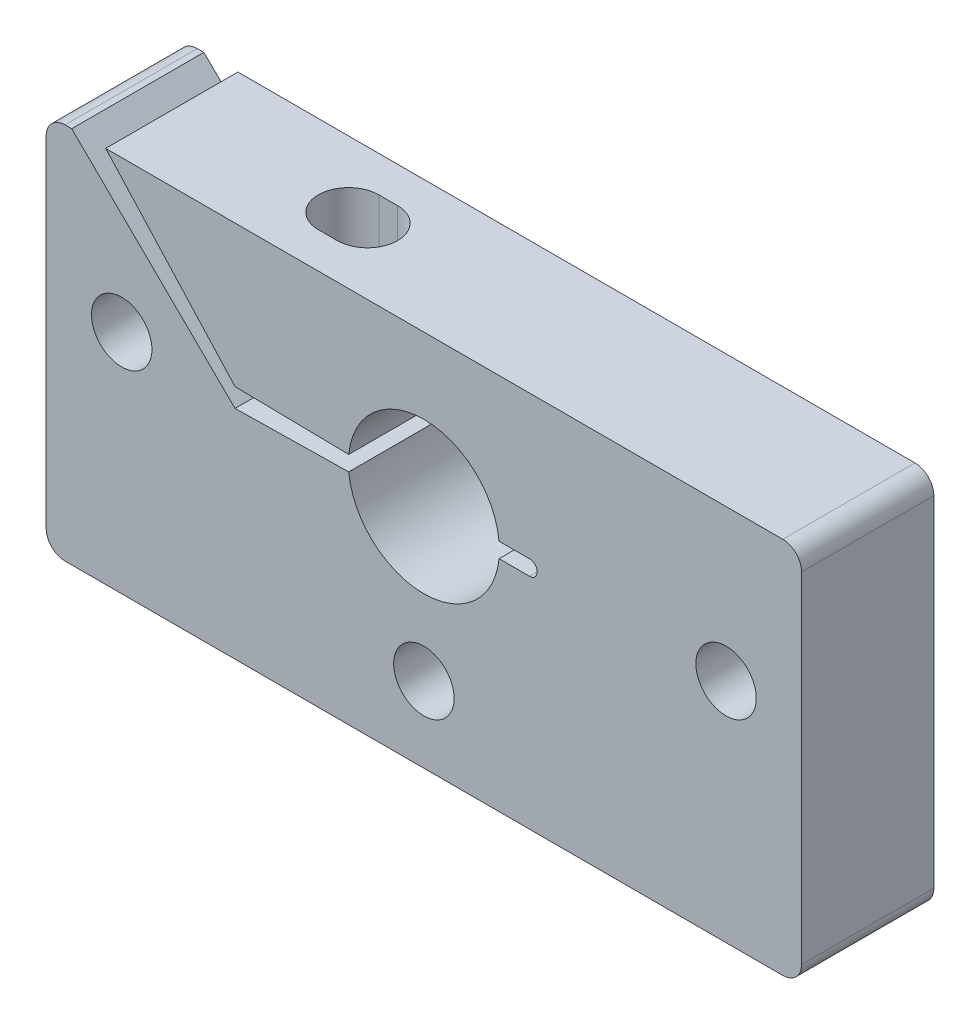
from build123d import *

# Parameters (mm, degrees)
BOSS_EXTRUDE1_DEPTH      = 3.5
BOSS_EXTRUDE1_DEPTH_BACK = 3.5
SKETCH1_R                = 1.6
CUT_EXTRUDE1_REACH       = 30.5
SKETCH3_R                = 1.6
SKETCH3_3_R              = 2.2
SKETCH3_3_R_2            = 1.6
CUT_EXTRUDE2_DEPTH       = 6
CUT_EXTRUDE3_REACH       = 30.5
FILLET1_R                = 1
FILLET2_R                = 0.4


with BuildPart() as part:
    # Sketch1 → Boss-Extrude1 (new, two sides: drawn at the far end of the back side and taken through both)
    with BuildSketch(Plane.XY.offset(-BOSS_EXTRUDE1_DEPTH_BACK)):
        with BuildLine():
            Line((-20, 8), (-18.64966284, 8))
            Line((-18.64966284, 8), (-10, -0.5))
            Line((-10, -0.5), (-3.979949748, -0.4))
            ThreePointArc((-3.979949748, -0.4), (0, -4), (3.979949748, -0.4))
            Line((3.979949748, -0.4), (6, -0.4))
            Line((6, -0.4), (6, 0.4))
            Line((6, 0.4), (3.979949748, 0.4))
            ThreePointArc((3.979949748, 0.4), (0, 4), (-3.979949748, 0.4))
            Line((-3.979949748, 0.4), (-10, 0.5))
            Line((-10, 0.5), (-16.848441102, 8))
            Line((-16.848441102, 8), (20, 8))
            Line((20, 8), (20, -12))
            Line((20, -12), (-20, -12))
            Line((-20, -12), (-20, 8))
        make_face()
        with Locations((-16, 0)):
            Circle(SKETCH1_R, mode=Mode.SUBTRACT)
        with Locations(Location((16, 0, 0), (0, 0, 180))):
            Circle(SKETCH1_R, mode=Mode.SUBTRACT)
        with Locations((0, -8)):
            Circle(SKETCH1_R, mode=Mode.SUBTRACT)
    extrude(amount=BOSS_EXTRUDE1_DEPTH + BOSS_EXTRUDE1_DEPTH_BACK)

    # Cut-Extrude1: up to this plane
    cut_extrude1_end = Plane(origin=(-10, -0.5, -3.5), z_dir=(-0.016608865731892127, 0.9998620632762801, 0))
    # Sketch3 → Cut-Extrude1 (cut, up to the surface)
    with BuildSketch(Plane.XZ.offset(12), mode=Mode.PRIVATE) as cut_extrude1_sk1:
        with Locations(Location((-6.989974874, 0, 0), (0, 0, 270))):
            Circle(SKETCH3_R)
    cut_extrude1_tool1 = split(extrude(cut_extrude1_sk1.sketch, amount=-CUT_EXTRUDE1_REACH, mode=Mode.PRIVATE), bisect_by=cut_extrude1_end, keep=Keep.BOTH, mode=Mode.PRIVATE)
    add(cut_extrude1_tool1.solids().sort_by_distance((-6.989975, -12, 0))[0], mode=Mode.SUBTRACT)

    # Sketch3<3> → Cut-Extrude2 (cut)
    with BuildSketch(Plane.XZ.offset(12)):
        with Locations(Location((-6.989974874, 0, 0), (0, 0, 270))):
            Circle(SKETCH3_3_R)
        with Locations(Location((-6.989974874, 0, 0), (0, 0, 270))):
            Circle(SKETCH3_3_R_2, mode=Mode.SUBTRACT)
    extrude(amount=-CUT_EXTRUDE2_DEPTH, mode=Mode.SUBTRACT)

    # Cut-Extrude3: up to this plane
    cut_extrude3_end = Plane(origin=(-10, 0.5, -3.5), z_dir=(-0.016608865731892127, -0.9998620632762801, 0))
    # Sketch4 → Cut-Extrude3 (cut, up to the surface)
    with BuildSketch(Plane(origin=(0, 8, 0), x_dir=(1, 0, 0), z_dir=(0, 1, 0)), mode=Mode.PRIVATE) as cut_extrude3_sk1:
        with BuildLine():
            Line((-7.489974874, 1.6), (-6.489974874, 1.6))
            ThreePointArc((-6.489974874, 1.6), (-4.889974874, 0), (-6.489974874, -1.6))
            Line((-6.489974874, -1.6), (-7.489974874, -1.6))
            ThreePointArc((-7.489974874, -1.6), (-9.089974874, 0), (-7.489974874, 1.6))
        make_face()
    cut_extrude3_tool1 = split(extrude(cut_extrude3_sk1.sketch, amount=-CUT_EXTRUDE3_REACH, mode=Mode.PRIVATE), bisect_by=cut_extrude3_end, keep=Keep.BOTH, mode=Mode.PRIVATE)
    add(cut_extrude3_tool1.solids().sort_by_distance((-6.989975, 8, 0))[0], mode=Mode.SUBTRACT)

    # Fillet1
    fillet1_edges = [part.edges().sort_by_distance(p)[0] for p in [
        (20, 8, 0),
        (20, -12, 0),
        (-20, -12, 0),
        (-20, 8, 0),
    ]]
    fillet(fillet1_edges, radius=FILLET1_R)

    # Fillet2
    fillet2_edges = [part.edges().sort_by_distance(p)[0] for p in [
        (6, -0.4, 0),
        (6, 0.4, 0),
    ]]
    fillet(fillet2_edges, radius=FILLET2_R - 0.0001)  # a hair under: the kernel refuses the full size


solid = part.part
